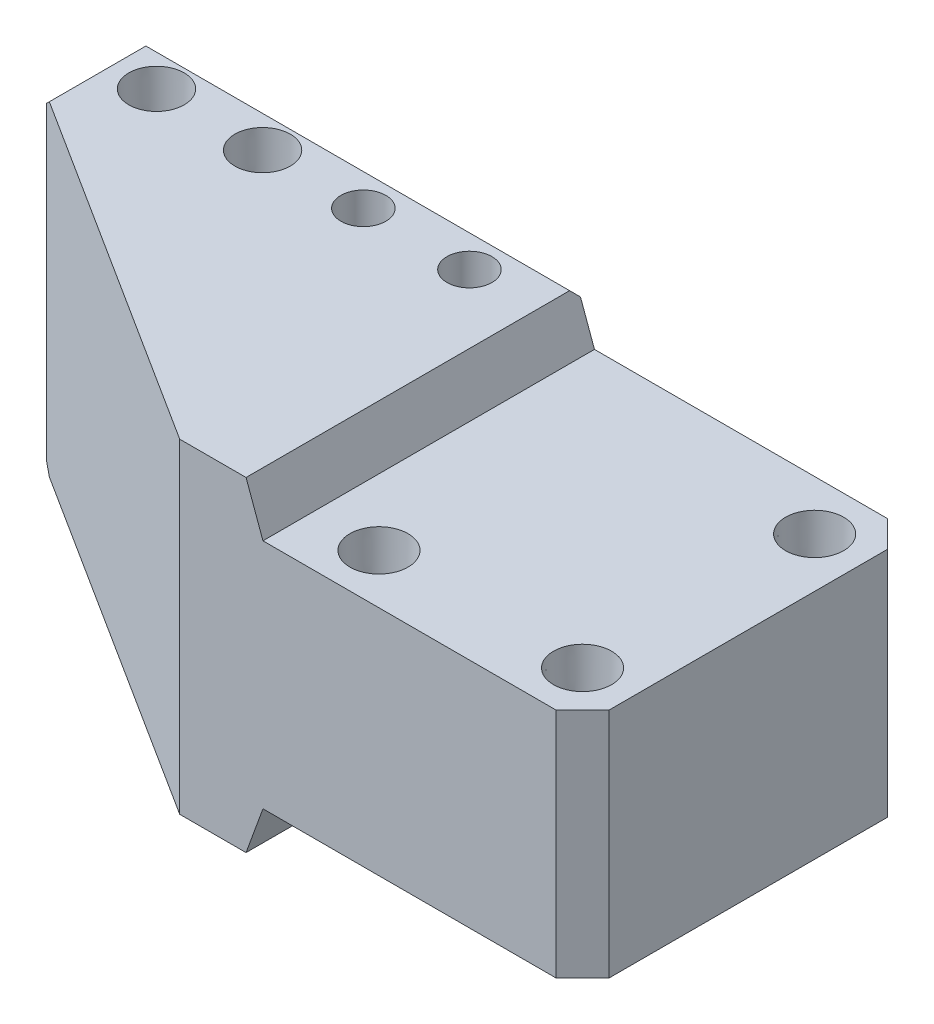
from build123d import *

# Parameters (mm, degrees)
SKETCH1_W                       = 42.960806382
SKETCH1_H                       = 31.115
BOSS_EXTRUDE1_DEPTH             = 12.7
SKETCH2_W                       = 42.960806382
SKETCH2_H                       = 22.225
BOSS_EXTRUDE2_DEPTH             = 19.05
BOSS_EXTRUDE3_DEPTH             = 22.225
DRAFT1_START                    = 15
DRAFT1_OUTLINE_W                = 22.225
DRAFT1_OUTLINE_H                = 19.270002336
DRAFT1_DEPTH                    = 6.752762537
BOSS_EXTRUDE4_REACH             = 69.308
SKETCH6_W                       = 42.960806382
SKETCH6_H                       = 4.445
DRAFT3_ANGLE                    = 20
DRAFT4_ANGLE                    = 20
BOSS_EXTRUDE5_DEPTH             = 22.225
F_6_CLEARANCE_HOLE1_D           = 4.3053
F_6_CLEARANCE_HOLE2_D           = 4.3053
F_6_CLEARANCE_HOLE2_ON_FACE_2_D = 4.3053
HOLE1_AT_2_COUNT                = 2
HOLE1_AT_2_PITCH                = 10.16
HOLE2_AT_2_COUNT                = 2
HOLE2_AT_2_PITCH                = 10.16
CUT_EXTRUDE1_DEPTH              = 70.758470007
CHAMFER1_SIZE                   = 2.54
CHAMFER2_SIZE                   = 0.762
HOLE3_AT_2_COUNT                = 2
HOLE3_AT_2_PITCH                = 19.49777111
HOLE3_AT_3_COUNT                = 2
HOLE3_AT_3_PITCH                = 29.565413971
HOLE4_AT_2_COUNT                = 2
HOLE4_AT_2_PITCH                = 22.225
HOLE4_AT_3_COUNT                = 2
HOLE4_AT_3_PITCH                = 29.565413971


with BuildPart() as part:
    # Sketch1 → Boss-Extrude1 (new body)
    with BuildSketch(Plane.XY):
        with Locations((1.668403191, -9.5885)):
            Rectangle(SKETCH1_W, SKETCH1_H)
    extrude(amount=BOSS_EXTRUDE1_DEPTH)

    # Sketch2 → Boss-Extrude2 (add)
    with BuildSketch(Plane.XY.offset(12.7)):
        with Locations((1.668403191, -9.5885)):
            Rectangle(SKETCH2_W, SKETCH2_H)
    extrude(amount=BOSS_EXTRUDE2_DEPTH)

    # Sketch3 → Boss-Extrude3 (add)
    with BuildSketch(Plane.XZ.offset(20.701)):
        Polygon((23.148806382, 31.75), (53.759077492, 31.75), (53.759077492, 0), (44.234077492, 0), (44.234077492, 18.107878998), (23.148806382, 18.107878998), align=None)
    extrude(amount=-BOSS_EXTRUDE3_DEPTH)

    # Draft1: read off the stored shape, not the designer's step
    # Draft1 outline → Draft1 (add)
    with BuildSketch(Plane(origin=(0, 0, 0), x_dir=(0, 1, 0), z_dir=(0.9396926207859083, 0, -0.3420201433256691)).offset(DRAFT1_START)):
        with Locations((-9.5885, 17.552359245)):
            Rectangle(DRAFT1_OUTLINE_W, DRAFT1_OUTLINE_H)
    extrude(amount=DRAFT1_DEPTH)

    # Sketch6 → Boss-Extrude4 (add, up to next)
    with BuildSketch(Plane.XY.offset(31.75), mode=Mode.PRIVATE) as boss_extrude4_sk1:
        with Locations((1.668403191, 3.7465)):
            Rectangle(SKETCH6_W, SKETCH6_H)
    boss_extrude4_tool1 = extrude(boss_extrude4_sk1.sketch, amount=-BOSS_EXTRUDE4_REACH, mode=Mode.PRIVATE) - part.part
    # Sketch6 → Boss-Extrude4 (add, up to next)
    with BuildSketch(Plane.XY.offset(31.75), mode=Mode.PRIVATE) as boss_extrude4_sk2:
        with Locations((1.668403191, -22.9235)):
            Rectangle(SKETCH6_W, SKETCH6_H)
    boss_extrude4_tool2 = extrude(boss_extrude4_sk2.sketch, amount=-BOSS_EXTRUDE4_REACH, mode=Mode.PRIVATE) - part.part
    add(boss_extrude4_tool1.solids().sort_by_distance((1.668403, 3.7465, 31.75))[0])
    add(boss_extrude4_tool2.solids().sort_by_distance((1.668403, -22.9235, 31.75))[0])

    # Draft3
    draft3_faces = [part.faces().sort_by_distance(p)[0] for p in [
        (23.148806382, -22.9235, 15.875),
    ]]
    draft(draft3_faces, Plane(origin=(23.148806382, -20.701, 31.75), x_dir=(-1, 0, 0), z_dir=(0, -1, 0)), DRAFT3_ANGLE)

    # Draft4
    draft4_faces = [part.faces().sort_by_distance(p)[0] for p in [
        (23.148806382, 3.7465, 15.875),
    ]]
    draft(draft4_faces, Plane(origin=(23.148806382, 1.524, 31.75), x_dir=(1, 0, 0), z_dir=(0, 1, 0)), DRAFT4_ANGLE)

    # Sketch8 → Boss-Extrude5 (add)
    with BuildSketch(Plane.XZ.offset(20.701)):
        Polygon((29.739535343, 18.107878998), (23.148806382, 0), (44.234077492, 0), (44.234077492, 18.107878998), align=None)
    extrude(amount=-BOSS_EXTRUDE5_DEPTH)

    # #6 Clearance Hole1 (through all)
    with Locations(Plane(origin=(0, -20.701, 0), x_dir=(-1, 0, 0), z_dir=(0, -1, 0))):
        with Locations((-48.996577492, -26.9875), (-48.996577492, -4.7625), (-29.498806382, -26.9875)):
            Hole(F_6_CLEARANCE_HOLE1_D / 2)

    # #6 Clearance Hole2 (through all)
    with Locations(Plane(origin=(-14.986, -25.146, 3.81), x_dir=(-1, 0, 0), z_dir=(0, -1, 0))):
        with Locations((0, 0), (-10.16, 0)):
            Hole(F_6_CLEARANCE_HOLE2_D / 2)

    # #6 Clearance Hole2 on face 2 (through all)
    with Locations(Plane(origin=(14.986, 5.969, 3.81), x_dir=(0, 0, 1), z_dir=(0, 1, 0))):
        with Locations((0, 0), (0, -10.16)):
            Hole(F_6_CLEARANCE_HOLE2_ON_FACE_2_D / 2)

    # Sketch18 → Hole1 (revolve, cut)
    with BuildSketch(Plane(origin=(-4.826, 5.969, 3.81), x_dir=(0, 0, 1), z_dir=(1, 0, 0))):
        Polygon((0, 0), (0, 3.81), (2.5273, 3.81), (2.6543, 0), align=None)
    hole1 = revolve(axis=Axis((-4.826, -104.031, 3.81), (0, 1, 0)), mode=Mode.SUBTRACT)

    # Hole1 at 2: Hole1 ×2
    with Locations(*[(-i * HOLE1_AT_2_PITCH, 0, 0) for i in range(1, HOLE1_AT_2_COUNT)]):
        add(hole1, mode=Mode.SUBTRACT)

    # Sketch20 → Hole2 (revolve, cut)
    with BuildSketch(Plane(origin=(4.826, -25.146, 3.81), x_dir=(0, 0, -1), z_dir=(1, 0, 0))):
        Polygon((0, 0), (0, 3.81), (2.5273, 3.81), (2.6543, 0), align=None)
    hole2 = revolve(axis=Axis((4.826, 84.854, 3.81), (0, -1, 0)), mode=Mode.SUBTRACT)

    # Hole2 at 2: Hole2 ×2
    with Locations(*[(i * HOLE2_AT_2_PITCH, 0, 0) for i in range(1, HOLE2_AT_2_COUNT)]):
        add(hole2, mode=Mode.SUBTRACT)

    # Sketch21 → Cut-Extrude1 (cut, through all)
    with BuildSketch(Plane(origin=(0, 5.969, 0), x_dir=(1, 0, 0), z_dir=(0, 1, 0))):
        Polygon((-19.812, -9.525), (-19.812, -31.75), (15.180958691, -31.75), align=None)
    extrude(amount=-CUT_EXTRUDE1_DEPTH, mode=Mode.SUBTRACT)

    # Chamfer1
    chamfer1_edges = [part.edges().sort_by_distance(p)[0] for p in [
        (53.759077492, -9.5885, 31.75),
        (53.759077492, -9.5885, 0),
    ]]
    chamfer(chamfer1_edges, length=CHAMFER1_SIZE)

    # Chamfer2
    chamfer2_edges = [part.edges().sort_by_distance(p)[0] for p in [
        (-19.812, -25.146, 4.7625),
        (-19.812, 5.969, 4.7625),
        (0.859479345, -25.146, 0),
        (-19.812, -9.5885, 0),
        (0.859479345, 5.969, 0),
    ]]
    chamfer(chamfer2_edges, length=CHAMFER2_SIZE)

    # Sketch23 → Hole3 (revolve, cut)
    with BuildSketch(Plane(origin=(29.498806382, 1.524, 26.9875), x_dir=(0, 0, 1), z_dir=(1, 0, 0))):
        Polygon((0, 0), (0, 3.81), (2.5781, 3.81), (2.7813, 0), align=None)
    hole3 = revolve(axis=Axis((29.498806382, -108.476, 26.9875), (0, 1, 0)), mode=Mode.SUBTRACT)

    # Hole3 at 2: Hole3 ×2
    with Locations(*[(i * HOLE3_AT_2_PITCH, 0, 0) for i in range(1, HOLE3_AT_2_COUNT)]):
        add(hole3, mode=Mode.SUBTRACT)

    # Hole3 at 3: Hole3 ×2
    with Locations(*[Vector(0.6594790497158223, 0, -0.7517229429689612) * (i * HOLE3_AT_3_PITCH) for i in range(1, HOLE3_AT_3_COUNT)]):
        add(hole3, mode=Mode.SUBTRACT)

    # Sketch25 → Hole4 (revolve, cut)
    with BuildSketch(Plane(origin=(48.996577492, -20.701, 4.7625), x_dir=(0, 0, -1), z_dir=(1, 0, 0))):
        Polygon((0, 0), (0, 3.81), (2.5781, 3.81), (2.7813, 0), align=None)
    hole4 = revolve(axis=Axis((48.996577492, 89.299, 4.7625), (0, -1, 0)), mode=Mode.SUBTRACT)

    # Hole4 at 2: Hole4 ×2
    with Locations(*[(0, 0, i * HOLE4_AT_2_PITCH) for i in range(1, HOLE4_AT_2_COUNT)]):
        add(hole4, mode=Mode.SUBTRACT)

    # Hole4 at 3: Hole4 ×2
    with Locations(*[Vector(-0.6594790497158223, 0, 0.7517229429689612) * (i * HOLE4_AT_3_PITCH) for i in range(1, HOLE4_AT_3_COUNT)]):
        add(hole4, mode=Mode.SUBTRACT)


solid = part.part
